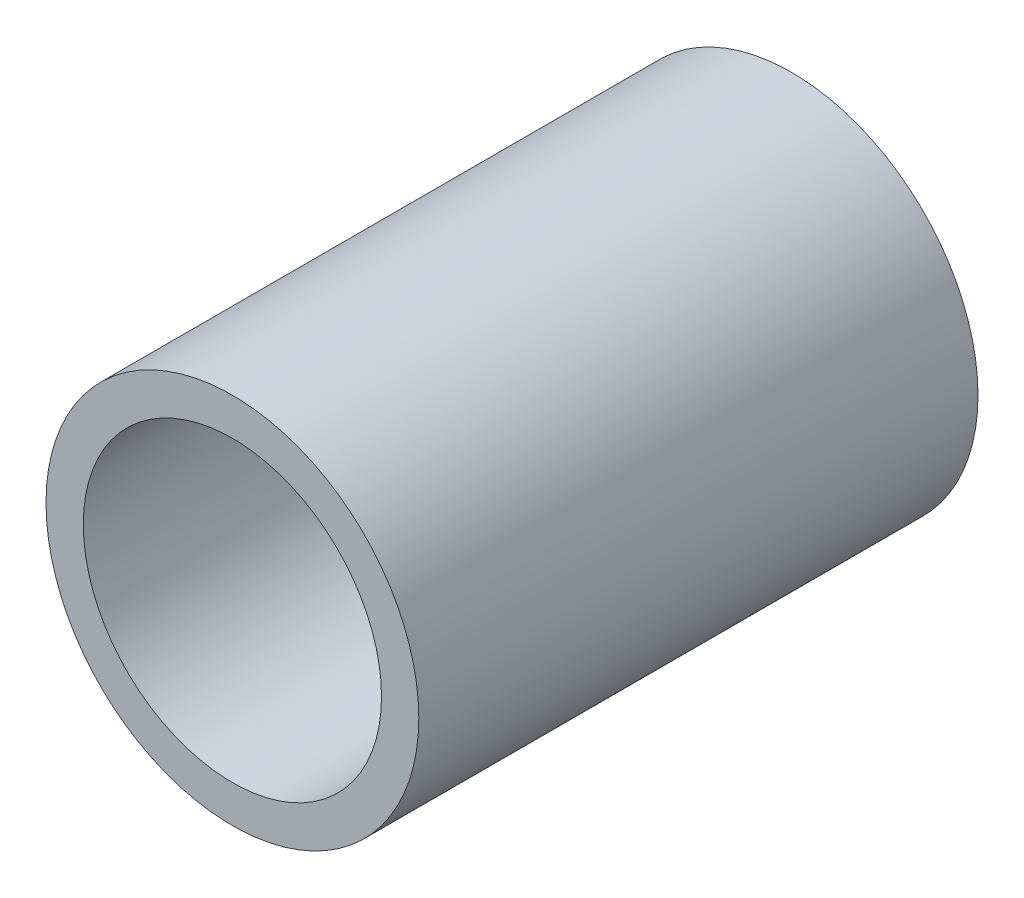
from build123d import *

# Parameters (mm, degrees)
ESQUISSE1_R        = 5
ESQUISSE1_R_2      = 4
BOSS_EXTRU_1_DEPTH = 15


with BuildPart() as part:
    # Esquisse1 → Boss.-Extru.1 (new body)
    with BuildSketch(Plane(origin=(0, 0, 0), x_dir=(0, 1, 0), z_dir=(0, 0, 1))):
        Circle(ESQUISSE1_R)
        Circle(ESQUISSE1_R_2, mode=Mode.SUBTRACT)
    extrude(amount=BOSS_EXTRU_1_DEPTH)


solid = part.part
